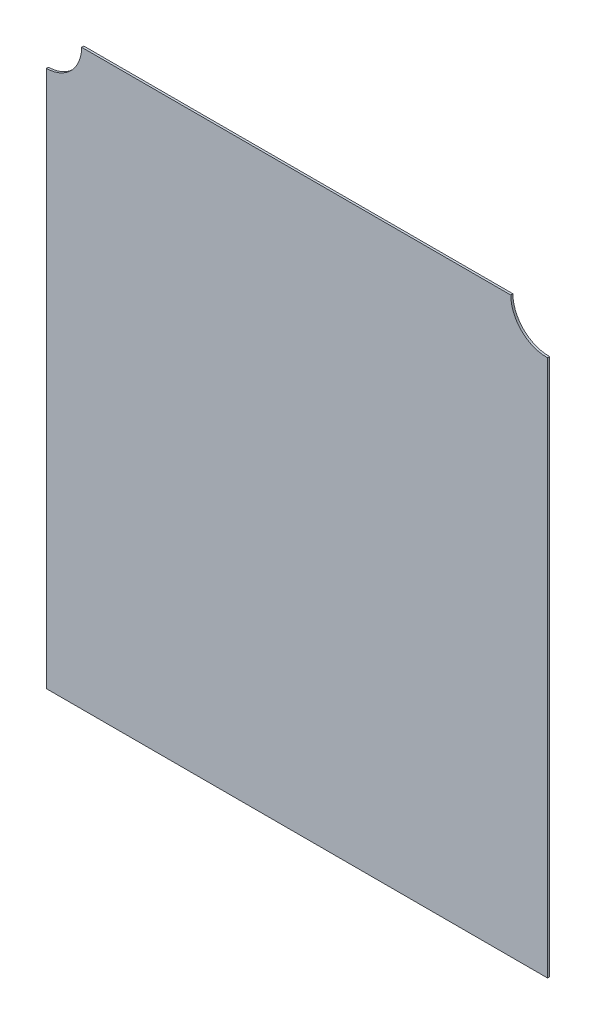
from build123d import *

# Parameters (mm, degrees)
SKETCH_1_W          = 696
SKETCH_1_H          = 796
EXTRUDE_5892_DEPTH  = 3
SKETCH_3_R          = 50
CUT_EXTRUDE_1_DEPTH = 3
SKETCH_4_R          = 50
CUT_EXTRUDE_2_DEPTH = 3


with BuildPart() as part:
    # Эскиз1 → Extrude 5892 (new body)
    with BuildSketch(Plane.XY):
        with Locations((348, 398)):
            Rectangle(SKETCH_1_W, SKETCH_1_H)
    extrude(amount=EXTRUDE_5892_DEPTH)

    # Эскиз3 → Cut-Extrude 1 (cut)
    with BuildSketch(Plane.XY.offset(3)):
        with Locations((-1, 796)):
            Circle(SKETCH_3_R)
    extrude(amount=-CUT_EXTRUDE_1_DEPTH, mode=Mode.SUBTRACT)

    # Эскиз4 → Cut-Extrude 2 (cut)
    with BuildSketch(Plane.XY.offset(3)):
        with Locations((695, 796)):
            Circle(SKETCH_4_R)
    extrude(amount=-CUT_EXTRUDE_2_DEPTH, mode=Mode.SUBTRACT)


solid = part.part
